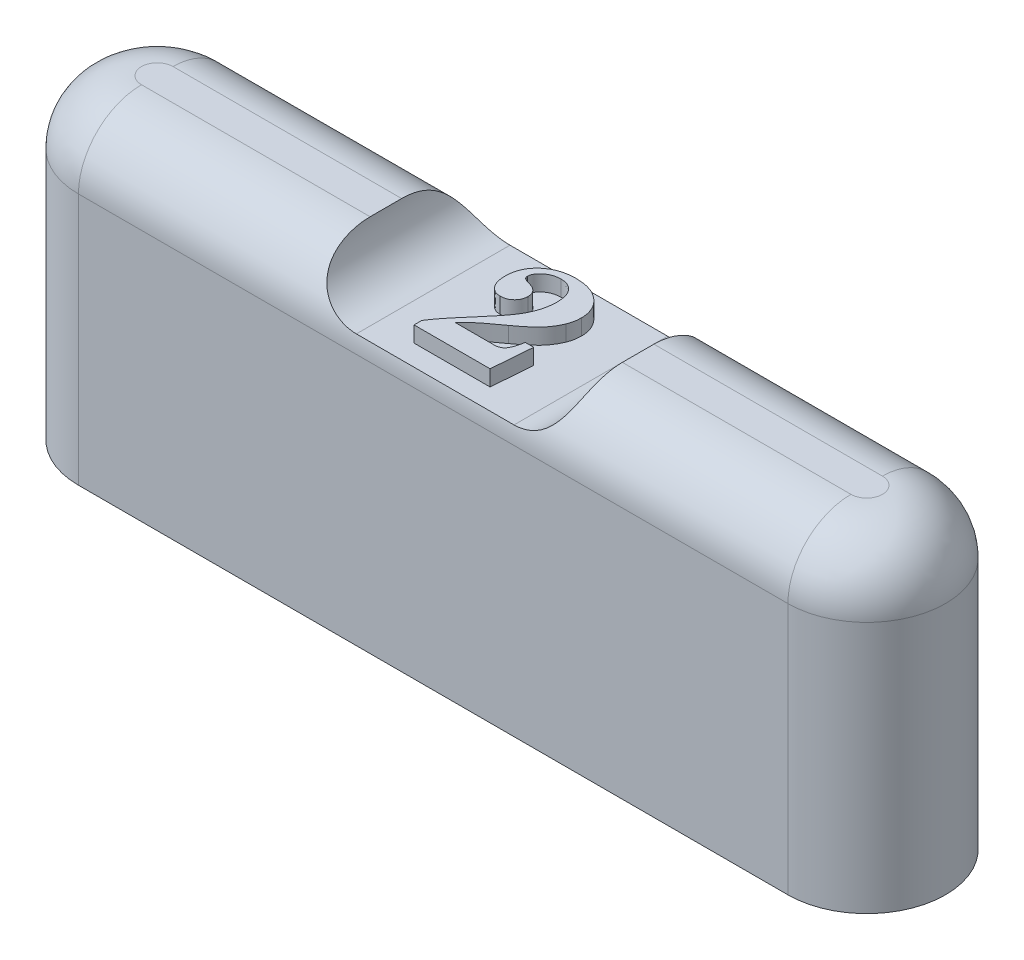
from build123d import *

# Parameters (mm, degrees)
BOSS_EXTRUDE1_DEPTH     = 20
FILLET1_R               = 4
SKETCH2_R               = 2.75
CUT_EXTRUDE1_DEPTH      = 1.5
LPATTERN1_COUNT         = 2
LPATTERN1_PITCH         = 30
CUT_EXTRUDE2_DEPTH      = 35.369317712
CUT_EXTRUDE2_DEPTH_BACK = 35.369317712
WRAP1_DEPTH             = 1


# Read off the part's stored shape, not the designer's step: Wrap1
with BuildPart() as part:
    # Sketch1 → Boss-Extrude1 (new body)
    with BuildSketch(Plane(origin=(0, 0, 0), x_dir=(1, 0, 0), z_dir=(0, 1, 0))):
        with BuildLine():
            Line((22.5, -5), (-22.5, -5))
            ThreePointArc((-22.5, -5), (-27.5, 0), (-22.5, 5))
            Line((-22.5, 5), (22.5, 5))
            ThreePointArc((22.5, 5), (27.5, 0), (22.5, -5))
        make_face()
    extrude(amount=BOSS_EXTRUDE1_DEPTH)

    # Fillet1
    fillet1_edges = [part.edges().sort_by_distance(p)[0] for p in [
        (-27.5, 20, 0),
        (0, 20, 5),
        (27.5, 20, 0),
        (0, 20, -5),
    ]]
    fillet(fillet1_edges, radius=FILLET1_R)

    # Sketch2 → Cut-Extrude1 (cut)
    with BuildSketch(Plane.XZ):
        with Locations(Location((-22.5, 0, 0), (0, 0, 270))):
            Circle(SKETCH2_R)
    cut_extrude1 = extrude(amount=-CUT_EXTRUDE1_DEPTH, mode=Mode.SUBTRACT)

    # LPattern1: Cut-Extrude1 ×2
    with Locations(*[(i * LPATTERN1_PITCH, 0, 0) for i in range(1, LPATTERN1_COUNT)]):
        add(cut_extrude1, mode=Mode.SUBTRACT)

    # Sketch3 → Cut-Extrude2 (cut, two sides: drawn at the far end of the back side and taken through both)
    with BuildSketch(Plane.XY.offset(-CUT_EXTRUDE2_DEPTH_BACK)):
        with BuildLine():
            Line((-5, 23), (5, 23))
            ThreePointArc((5, 23), (8, 20), (5, 17))
            Line((5, 17), (-5, 17))
            ThreePointArc((-5, 17), (-8, 20), (-5, 23))
        make_face()
    extrude(amount=CUT_EXTRUDE2_DEPTH + CUT_EXTRUDE2_DEPTH_BACK, mode=Mode.SUBTRACT)

    # Wrap1 outline → Wrap1 (add)
    with BuildSketch(Plane(origin=(0, 17, 0), x_dir=(1, 0, 0), z_dir=(0, 1, 0))):
        with BuildLine():
            add(Edge.make_bspline(
                [(0.968558604, -2.112404227), (1.023340463, -2.110381468), (1.128135866, -2.106512015), (1.275421614, -2.065066433), (1.40411806, -1.999153831), (1.494113345, -1.918796765), (1.555259283, -1.8377784), (1.600182088, -1.761379971), (1.643056037, -1.669468115), (1.68410688, -1.562162987), (1.724115658, -1.439672484), (1.762787282, -1.301883834), (1.796828359, -1.147944523), (1.819117415, -1.040313742), (1.830738091, -0.984199098)],
                knots=[0, 0, 0, 0, 0.10403341, 0.199011557, 0.288612319, 0.377191825, 0.425797175, 0.481425289, 0.545557079, 0.61863331, 0.699984683, 0.790771883, 0.890916323, 1, 1, 1, 1], degree=3))
            Line((0.968558604, -2.112404227), (-1.502595242, -2.112404227))
            add(Edge.make_bspline(
                [(0.359584245, -0.57875038), (0.287589412, -0.631266446), (0.149119993, -0.732271876), (-0.052040125, -0.874957595), (-0.232151558, -1.010570949), (-0.396984875, -1.13231455), (-0.543079134, -1.243803459), (-0.672030163, -1.343433338), (-0.782764208, -1.43141572), (-0.961872458, -1.579798827), (-1.207220157, -1.798528227), (-1.40469562, -2.00837263), (-1.502595242, -2.112404227)],
                knots=[0, 0, 0, 0, 0.110593572, 0.212707314, 0.306051588, 0.390379305, 0.467018215, 0.534117187, 0.592614819, 0.642525788, 0.822780058, 1, 1, 1, 1], degree=3))
            add(Edge.make_bspline(
                [(2.103173989, 1.329903466), (2.066781163, 1.246346618), (1.99482956, 1.081147874), (1.86047631, 0.847661593), (1.71297016, 0.626020413), (1.571074283, 0.452909604), (1.445054335, 0.315568643), (1.334068385, 0.207346612), (1.208958187, 0.091994137), (1.069166496, -0.030104), (0.913592831, -0.158279882), (0.741560734, -0.29208501), (0.556771712, -0.435146764), (0.42660857, -0.529939289), (0.359584245, -0.57875038)],
                knots=[0, 0, 0, 0, 0.10413489, 0.205883221, 0.307528832, 0.408265615, 0.461433854, 0.520606469, 0.585444086, 0.656004792, 0.732803839, 0.815893726, 0.905198979, 1, 1, 1, 1], degree=3))
            add(Edge.make_bspline(
                [(2.258622707, 2.155223979), (2.256854974, 2.081406691), (2.253395008, 1.936924834), (2.223825952, 1.724789841), (2.174767432, 1.522306219), (2.126875674, 1.393600214), (2.103173989, 1.329903466)],
                knots=[0, 0, 0, 0, 0.261979501, 0.512769921, 0.758869279, 1, 1, 1, 1], degree=3))
            add(Edge.make_bspline(
                [(-0.061890114, 4.14400603), (0.022564629, 4.141920306), (0.18812583, 4.13783155), (0.430620451, 4.112847977), (0.660471364, 4.067558501), (0.878305178, 4.005888588), (1.082018473, 3.923000729), (1.274759097, 3.825795699), (1.453280397, 3.707304776), (1.618929442, 3.573545968), (1.768923738, 3.427244365), (1.900049838, 3.270535022), (2.011299511, 3.105351175), (2.101257211, 2.93081783), (2.172841542, 2.749020464), (2.221753805, 2.558426678), (2.253872753, 2.359840276), (2.257020026, 2.224263519), (2.258622707, 2.155223979)],
                knots=[0, 0, 0, 0, 0.074102612, 0.14526736, 0.21355926, 0.279416432, 0.343556942, 0.406228654, 0.468492489, 0.531146675, 0.592790073, 0.652016559, 0.710119813, 0.767135501, 0.823967905, 0.881147087, 0.939476717, 1, 1, 1, 1], degree=3))
            add(Edge.make_bspline(
                [(-1.906441396, 3.445288081), (-1.848306189, 3.501112989), (-1.732554849, 3.612264359), (-1.538609793, 3.754854821), (-1.330466242, 3.876473687), (-1.105791254, 3.973994027), (-0.866480346, 4.051164268), (-0.611446439, 4.105367467), (-0.341562002, 4.137488539), (-0.156530269, 4.14180053), (-0.061890114, 4.14400603)],
                knots=[0, 0, 0, 0, 0.119107626, 0.23715177, 0.355050392, 0.47498588, 0.598670295, 0.726365388, 0.860041186, 1, 1, 1, 1], degree=3))
            add(Edge.make_bspline(
                [(-2.459326011, 2.031826543), (-2.458122329, 2.10083777), (-2.455751672, 2.236755643), (-2.42704922, 2.435648535), (-2.383831572, 2.625974396), (-2.325084873, 2.808678323), (-2.245799792, 2.981581962), (-2.150493697, 3.146407777), (-2.038697096, 3.303051555), (-1.950794522, 3.397587797), (-1.906441396, 3.445288081)],
                knots=[0, 0, 0, 0, 0.132803649, 0.26155729, 0.386082589, 0.508400008, 0.630401232, 0.751619273, 0.874674186, 1, 1, 1, 1], degree=3))
            add(Edge.make_bspline(
                [(-1.520223447, 0.759390645), (-1.585420599, 0.763118791), (-1.713143024, 0.770422298), (-1.895082142, 0.836934937), (-2.058691576, 0.943915448), (-2.201841078, 1.092044894), (-2.320121913, 1.277705611), (-2.399559254, 1.501224402), (-2.452612405, 1.75530448), (-2.457009968, 1.936432658), (-2.459326011, 2.031826543)],
                knots=[0, 0, 0, 0, 0.110139331, 0.215764983, 0.323707128, 0.438906263, 0.562183724, 0.693638164, 0.838649921, 1, 1, 1, 1], degree=3))
            add(Edge.make_bspline(
                [(-0.613172165, 1.631185517), (-0.616054345, 1.570486701), (-0.621662157, 1.45238594), (-0.671323685, 1.283175242), (-0.754629801, 1.131365188), (-0.869218028, 1.000302814), (-1.00648217, 0.893380798), (-1.162575656, 0.81342959), (-1.336719307, 0.768952542), (-1.458017598, 0.762632021), (-1.520223447, 0.759390645)],
                knots=[0, 0, 0, 0, 0.129242333, 0.251464839, 0.372304265, 0.495878621, 0.620081591, 0.741344555, 0.867352775, 1, 1, 1, 1], degree=3))
            add(Edge.make_bspline(
                [(-1.273428575, 2.371570132), (-1.221111857, 2.356431424), (-1.121681232, 2.327659528), (-0.986315759, 2.264054818), (-0.872118751, 2.188748181), (-0.775565412, 2.103031066), (-0.702763657, 2.001965174), (-0.650977929, 1.888692008), (-0.61737495, 1.763975364), (-0.614599413, 1.676280399), (-0.613172165, 1.631185517)],
                knots=[0, 0, 0, 0, 0.151156851, 0.287281401, 0.413669873, 0.530293514, 0.644009236, 0.756908248, 0.874996313, 1, 1, 1, 1], degree=3))
            add(Edge.make_bspline(
                [(-1.659646524, 2.52701885), (-1.641908981, 2.5134804), (-1.599762076, 2.48131113), (-1.513799429, 2.446453071), (-1.403911325, 2.405291879), (-1.319666952, 2.383519902), (-1.273428575, 2.371570132)],
                knots=[0, 0, 0, 0, 0.159109439, 0.378066483, 0.65864549, 1, 1, 1, 1], degree=3))
            add(Edge.make_bspline(
                [(-1.741377293, 2.725736799), (-1.740702967, 2.705828636), (-1.739402264, 2.667427893), (-1.722346439, 2.613602242), (-1.696843256, 2.565494988), (-1.672067897, 2.539867464), (-1.659646524, 2.52701885)],
                knots=[0, 0, 0, 0, 0.268945253, 0.518766978, 0.758729042, 1, 1, 1, 1], degree=3))
            add(Edge.make_bspline(
                [(-0.509005498, 3.631185517), (-0.593702292, 3.627478268), (-0.757485819, 3.620309328), (-0.992510379, 3.565399378), (-1.204920463, 3.4708981), (-1.388970755, 3.342097951), (-1.54050767, 3.195942921), (-1.655393233, 3.044422755), (-1.727025811, 2.886507887), (-1.736695124, 2.778188345), (-1.741377293, 2.725736799)],
                knots=[0, 0, 0, 0, 0.151816317, 0.293576777, 0.429964406, 0.566304914, 0.694365033, 0.806085808, 0.906100976, 1, 1, 1, 1], degree=3))
            add(Edge.make_bspline(
                [(0.617597066, 2.220929107), (0.616798314, 2.277062503), (0.615251229, 2.385786079), (0.599863671, 2.542997259), (0.579004071, 2.690242583), (0.544058374, 2.826348498), (0.504153512, 2.954009696), (0.449772713, 3.069509609), (0.389899195, 3.176431124), (0.318093883, 3.271087373), (0.240513737, 3.356936451), (0.152380296, 3.428872442), (0.059506725, 3.491963217), (-0.040243661, 3.543993611), (-0.147906764, 3.581901434), (-0.261368703, 3.611540097), (-0.38306343, 3.626855058), (-0.466235221, 3.629714881), (-0.509005498, 3.631185517)],
                knots=[0, 0, 0, 0, 0.082284271, 0.159374645, 0.231497254, 0.300083139, 0.36523236, 0.427274673, 0.486932074, 0.544586116, 0.60112786, 0.656190593, 0.710940404, 0.765594865, 0.820607428, 0.877984079, 0.93725451, 1, 1, 1, 1], degree=3))
            add(Edge.make_bspline(
                [(0.205738091, 0.635993209), (0.238640814, 0.700768661), (0.303861654, 0.829168655), (0.385865127, 1.026897746), (0.459663901, 1.22391557), (0.516579645, 1.422967903), (0.561905142, 1.621957205), (0.593823909, 1.82108009), (0.613938148, 2.020726724), (0.616375849, 2.154108657), (0.617597066, 2.220929107)],
                knots=[0, 0, 0, 0, 0.131745637, 0.261150462, 0.388067803, 0.513189353, 0.636374668, 0.758087597, 0.878808958, 1, 1, 1, 1], degree=3))
            add(Edge.make_bspline(
                [(-1.116377293, -1.107596534), (-1.03496234, -1.013767374), (-0.878016077, -0.832889839), (-0.655626445, -0.569536189), (-0.456135085, -0.32390871), (-0.280159151, -0.096566641), (-0.125247461, 0.111659158), (0.00577288, 0.302221735), (0.116680709, 0.473318508), (0.177475044, 0.584367138), (0.205738091, 0.635993209)],
                knots=[0, 0, 0, 0, 0.170005554, 0.327725258, 0.471696803, 0.603008639, 0.721148947, 0.826797124, 0.919478664, 1, 1, 1, 1], degree=3))
            add(Edge.make_bspline(
                [(-2.664454216, -3.057917047), (-2.628698989, -3.000910883), (-2.55158858, -2.877970296), (-2.41479269, -2.688825323), (-2.259314405, -2.474715573), (-2.074551732, -2.243606397), (-1.870318919, -1.988170585), (-1.640593125, -1.712928149), (-1.387471618, -1.416348269), (-1.20904993, -1.213142224), (-1.116377293, -1.107596534)],
                knots=[0, 0, 0, 0, 0.080973991, 0.174630064, 0.280853316, 0.39944862, 0.530692677, 0.674513651, 0.830941638, 1, 1, 1, 1], degree=3))
            Line((-2.664454216, -3.057917047), (-2.664454216, -3.548301662))
            Line((-2.664454216, -3.548301662), (2.156058604, -3.548301662))
            Line((2.156058604, -3.548301662), (2.361186809, -0.984199098))
            Line((2.361186809, -0.984199098), (1.830738091, -0.984199098))
        make_face()
    extrude(amount=WRAP1_DEPTH)


solid = part.part
